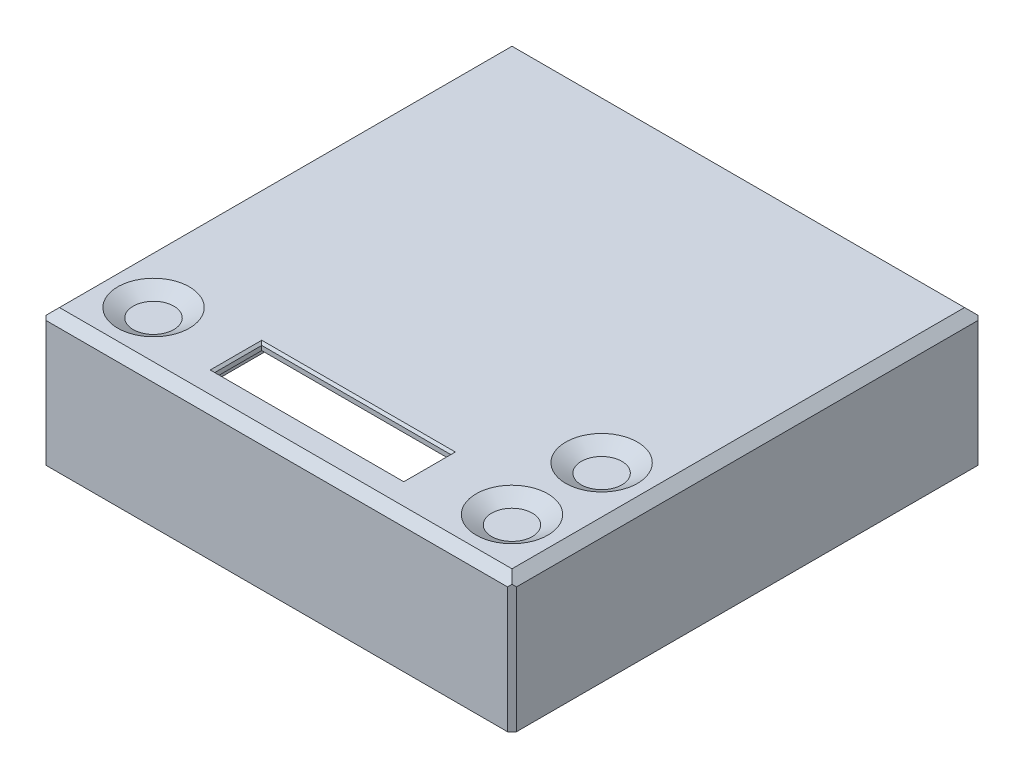
from build123d import *
from OCP.BRepFilletAPI import BRepFilletAPI_MakeChamfer

# Parameters (mm, degrees)
SKETCH_2_W          = 105
SKETCH_2_H          = 105
SKETCH_2_W_2        = 101
SKETCH_2_H_2        = 101
EXTRUDE_1_DEPTH     = 25
SKETCH_2_2_W        = 105
SKETCH_2_2_H        = 105
EXTRUDE_2_DEPTH     = 5
SKETCH_3_R          = 2
CUT_EXTRUDE_1_DEPTH = 3.5
SKETCH_4_R          = 1.5
EXTRUDE_3_DEPTH     = 3
SKETCH_6_R          = 0.75
SKETCH_6_W          = 9
SKETCH_6_H          = 3.5
CUT_EXTRUDE_3_DEPTH = 79.34219808
CHAMFER_3_SIZE      = 2
CHAMFER_2_SIZE      = 1
CUT_EXTRUDE_START   = 5
SKETCH_7_R          = 8
CUT_EXTRUDE_4_DEPTH = 2
CHAMFER_4_SIZE      = 2
CHAMFER_4_SIZE_2    = 3.464101615
SKETCH_8_W          = 43.2
SKETCH_8_H          = 11.5
CUT_EXTRUDE_5_DEPTH = 0.5
CHAMFER_5_SIZE      = 0.5
SKETCH_9_W          = 15.083333334
SKETCH_9_H          = 15.083333
SKETCH_9_W_2        = 15.083333333
SKETCH_9_W_3        = 13.766666667
SKETCH_9_H_2        = 8.583333
SKETCH_9_H_3        = 13.7666664
SKETCH_9_H_4        = 10.9499998
CUT_EXTRUDE_6_DEPTH = 3.5
CUT_EXTRUDE_START_2 = 4.5
SKETCH_10_W         = 42.2
SKETCH_10_H         = 10.5
CUT_EXTRUDE_7_DEPTH = 6
SKETCH_11_W         = 2.1
SKETCH_11_H         = 3.6333332
SKETCH_11_H_2       = 3.979949748
CUT_EXTRUDE_8_DEPTH = 3.5


with BuildPart() as part:
    # 草图2 → 凸台-拉伸1 (new body)
    with BuildSketch(Plane(origin=(0, 0, 0), x_dir=(1, 0, 0), z_dir=(0, 1, 0))):
        Rectangle(SKETCH_2_W, SKETCH_2_H)
        Rectangle(SKETCH_2_W_2, SKETCH_2_H_2, mode=Mode.SUBTRACT)
    extrude(amount=-EXTRUDE_1_DEPTH)

    # 草图2<2> → 凸台-拉伸2 (add)
    with BuildSketch(Plane(origin=(0, 0, 0), x_dir=(1, 0, 0), z_dir=(0, 1, 0))):
        Rectangle(SKETCH_2_2_W, SKETCH_2_2_H)
    extrude(amount=EXTRUDE_2_DEPTH)

    # 草图3 → 切除-拉伸1 (cut)
    with BuildSketch(Plane(origin=(0, 0, 0), x_dir=(1, 0, 0), z_dir=(0, 1, 0))):
        with Locations(Location((-30, -30, 0), (0, 0, 270))):
            Circle(SKETCH_3_R)
        with Locations(Location((-45, 45, 0), (0, 0, 270))):
            Circle(SKETCH_3_R)
        with Locations(Location((45, 45, 0), (0, 0, 270))):
            Circle(SKETCH_3_R)
        Polygon((28, -31), (28, -35), (30, -35), (30, -45), (28, -45), (28, -49), (-24, -49), (-24, -31), align=None)
    extrude(amount=CUT_EXTRUDE_1_DEPTH, mode=Mode.SUBTRACT)

    # 草图4 → 凸台-拉伸3 (add)
    with BuildSketch(Plane(origin=(0, 0, 0), x_dir=(1, 0, 0), z_dir=(0, 1, 0))):
        with Locations(Location((30, -30, 0), (0, 0, 270))):
            Circle(SKETCH_4_R)
    extrude(amount=-EXTRUDE_3_DEPTH)

    # 草图6 → 切除-拉伸3 (cut, through all)
    with BuildSketch(Plane.XY):
        with Locations((-10, -2.25)):
            Circle(SKETCH_6_R)
        with Locations((0, -3.25)):
            Rectangle(SKETCH_6_W, SKETCH_6_H)
    extrude(amount=-CUT_EXTRUDE_3_DEPTH, mode=Mode.SUBTRACT)

    # 倒角3
    chamfer_3_edges = [part.edges().sort_by_distance(p)[0] for p in [
        (52.5, 5, 0),
        (0, 5, -52.5),
        (-52.5, 5, 0),
        (0, 5, 52.5),
    ]]
    chamfer(chamfer_3_edges, length=CHAMFER_3_SIZE)

    # 倒角2
    chamfer_2_edges = [part.edges().sort_by_distance(p)[0] for p in [
        (52.5, -11, 52.5),
        (-52.5, -11, 52.5),
        (-52.5, -11, -52.5),
        (52.5, -11, -52.5),
    ]]
    chamfer(chamfer_2_edges, length=CHAMFER_2_SIZE)

    # 草图7 → 切除-拉伸4 (cut)
    with BuildSketch(Plane(origin=(0, 0, 0), x_dir=(1, 0, 0), z_dir=(0, 1, 0)).offset(CUT_EXTRUDE_START)):
        with Locations(Location((-40, -40, 0), (0, 0, 270))):
            Circle(SKETCH_7_R)
        with Locations(Location((40, -40, 0), (0, 0, 270))):
            Circle(SKETCH_7_R)
        with Locations(Location((40, -20, 0), (0, 0, 270))):
            Circle(SKETCH_7_R)
    extrude(amount=-CUT_EXTRUDE_4_DEPTH, mode=Mode.SUBTRACT)

    # 倒角4
    chamfer_4_edges_1 = [part.edges().sort_by_distance(p)[0] for p in [
        (-40, 3, 32),
    ]]
    chamfer_4_side_1 = [part.faces().sort_by_distance(p)[0] for p in [
        (-40, 3.04, 32),
    ]]
    chamfer_4_edges_2 = [part.edges().sort_by_distance(p)[0] for p in [
        (40, 3, 32),
    ]]
    chamfer_4_side_2 = [part.faces().sort_by_distance(p)[0] for p in [
        (40, 3.04, 32),
    ]]
    chamfer_4_edges_3 = [part.edges().sort_by_distance(p)[0] for p in [
        (40, 3, 12),
    ]]
    chamfer_4_side_3 = [part.faces().sort_by_distance(p)[0] for p in [
        (40, 3.04, 12),
    ]]
    chamfer_4 = BRepFilletAPI_MakeChamfer(part.part.solid().wrapped)
    for e in chamfer_4_edges_1:
        chamfer_4.Add(CHAMFER_4_SIZE - 0.0001, CHAMFER_4_SIZE_2 - 0.0001, e.wrapped, chamfer_4_side_1[0].wrapped)
    for e in chamfer_4_edges_2:
        chamfer_4.Add(CHAMFER_4_SIZE - 0.0001, CHAMFER_4_SIZE_2 - 0.0001, e.wrapped, chamfer_4_side_2[0].wrapped)
    for e in chamfer_4_edges_3:
        chamfer_4.Add(CHAMFER_4_SIZE - 0.0001, CHAMFER_4_SIZE_2 - 0.0001, e.wrapped, chamfer_4_side_3[0].wrapped)
    add(Compound.cast(chamfer_4.Shape()), mode=Mode.REPLACE)  # a hair under: the kernel refuses the full size

    # 草图8 → 切除-拉伸5 (cut)
    with BuildSketch(Plane(origin=(0, 0, 0), x_dir=(1, 0, 0), z_dir=(0, 1, 0)).offset(CUT_EXTRUDE_START)):
        with Locations((0, -40)):
            Rectangle(SKETCH_8_W, SKETCH_8_H)
    extrude(amount=-CUT_EXTRUDE_5_DEPTH, mode=Mode.SUBTRACT)

    # 倒角5
    chamfer_5_edges = [part.edges().sort_by_distance(p)[0] for p in [
        (0, 4.5, 45.75),
        (21.6, 4.5, 40),
        (-21.6, 4.5, 40),
        (0, 4.5, 34.25),
    ]]
    chamfer(chamfer_5_edges, length=CHAMFER_5_SIZE - 0.0001)  # a hair under: the kernel refuses the full size

    # 草图9 → 切除-拉伸6 (cut)
    with BuildSketch(Plane(origin=(0, 0, 0), x_dir=(1, 0, 0), z_dir=(0, 1, 0))):
        with BuildLine():
            Line((50.5, 35.416667), (35.416666667, 35.416667))
            Line((35.416666667, 35.416667), (35.416666667, 50.5))
            Line((35.416666667, 50.5), (39.5, 50.5))
            Line((39.5, 50.5), (39.5, 45))
            ThreePointArc((39.5, 45), (41.110912703, 41.110912703), (45, 39.5))
            Line((45, 39.5), (50.5, 39.5))
            Line((50.5, 39.5), (50.5, 35.416667))
        make_face()
        with Locations((25.775, 42.9583335)):
            Rectangle(SKETCH_9_W, SKETCH_9_H)
        with Locations((8.591666667, 42.9583335)):
            Rectangle(SKETCH_9_W_2, SKETCH_9_H)
        with Locations((-8.591666667, 42.9583335)):
            Rectangle(SKETCH_9_W_2, SKETCH_9_H)
        with Locations((-25.775, 42.9583335)):
            Rectangle(SKETCH_9_W, SKETCH_9_H)
        with BuildLine():
            Line((-35.416666667, 35.416667), (-35.416666667, 50.5))
            Line((-35.416666667, 50.5), (-39.5, 50.5))
            Line((-39.5, 50.5), (-39.5, 45))
            ThreePointArc((-39.5, 45), (-41.110912703, 41.110912703), (-45, 39.5))
            Line((-45, 39.5), (-50.5, 39.5))
            Line((-50.5, 39.5), (-50.5, 35.416667))
            Line((-50.5, 35.416667), (-35.416666667, 35.416667))
        make_face()
        with Locations((25.775, 25.7750001)):
            Rectangle(SKETCH_9_W, SKETCH_9_H)
        with Locations((8.591666667, 25.7750001)):
            Rectangle(SKETCH_9_W_2, SKETCH_9_H)
        with Locations((-8.591666667, 25.7750001)):
            Rectangle(SKETCH_9_W_2, SKETCH_9_H)
        with Locations((-25.775, 25.7750001)):
            Rectangle(SKETCH_9_W, SKETCH_9_H)
        with Locations((-42.958333334, 25.7750001)):
            Rectangle(SKETCH_9_W_2, SKETCH_9_H)
        with Locations((25.775, 8.5916667)):
            Rectangle(SKETCH_9_W, SKETCH_9_H)
        with Locations((8.591666667, 8.5916667)):
            Rectangle(SKETCH_9_W_2, SKETCH_9_H)
        with Locations((-8.591666667, 8.5916667)):
            Rectangle(SKETCH_9_W_2, SKETCH_9_H)
        with Locations((-25.775, 8.5916667)):
            Rectangle(SKETCH_9_W, SKETCH_9_H)
        with Locations((-42.958333334, 8.5916667)):
            Rectangle(SKETCH_9_W_2, SKETCH_9_H)
        with Locations((25.775, -8.5916667)):
            Rectangle(SKETCH_9_W, SKETCH_9_H)
        with Locations((8.591666667, -8.5916667)):
            Rectangle(SKETCH_9_W_2, SKETCH_9_H)
        with Locations((-8.591666667, -8.5916667)):
            Rectangle(SKETCH_9_W_2, SKETCH_9_H)
        with Locations((-25.775, -8.5916667)):
            Rectangle(SKETCH_9_W, SKETCH_9_H)
        with Locations((-42.958333334, -8.5916667)):
            Rectangle(SKETCH_9_W_2, SKETCH_9_H)
        with Locations((25.116666667, -22.5250001)):
            Rectangle(SKETCH_9_W_3, SKETCH_9_H_2)
        with Locations((8.591666667, -22.5250001)):
            Rectangle(SKETCH_9_W_2, SKETCH_9_H_2)
        with Locations((-8.591666667, -22.5250001)):
            Rectangle(SKETCH_9_W_2, SKETCH_9_H_2)
        with Locations((-25.775, -22.5250001)):
            Rectangle(SKETCH_9_W, SKETCH_9_H_2)
        with Locations((-42.958333334, -25.1166668)):
            Rectangle(SKETCH_9_W_2, SKETCH_9_H_3)
        with Locations((42.958333334, 25.7750001)):
            Rectangle(SKETCH_9_W_2, SKETCH_9_H)
        with Locations((42.958333334, 8.5916667)):
            Rectangle(SKETCH_9_W_2, SKETCH_9_H)
        with Locations((42.958333334, -6.5250001)):
            Rectangle(SKETCH_9_W_2, SKETCH_9_H_4)
    extrude(amount=CUT_EXTRUDE_6_DEPTH, mode=Mode.SUBTRACT)

    # 草图10 → 切除-拉伸7 (cut)
    with BuildSketch(Plane(origin=(0, 0, 0), x_dir=(1, 0, 0), z_dir=(0, 1, 0)).offset(CUT_EXTRUDE_START_2)):
        with Locations((0, -40)):
            Rectangle(SKETCH_10_W, SKETCH_10_H)
    extrude(amount=-CUT_EXTRUDE_7_DEPTH, mode=Mode.SUBTRACT)

    # 草图11 → 切除-拉伸8 (cut)
    with BuildSketch(Plane(origin=(0, 0, 0), x_dir=(1, 0, 0), z_dir=(0, 1, 0))):
        with Locations((0, -25)):
            Rectangle(SKETCH_11_W, SKETCH_11_H)
        with Locations((0, -10)):
            Rectangle(SKETCH_11_W, SKETCH_11_H_2)
    extrude(amount=CUT_EXTRUDE_8_DEPTH, mode=Mode.SUBTRACT)


solid = part.part
